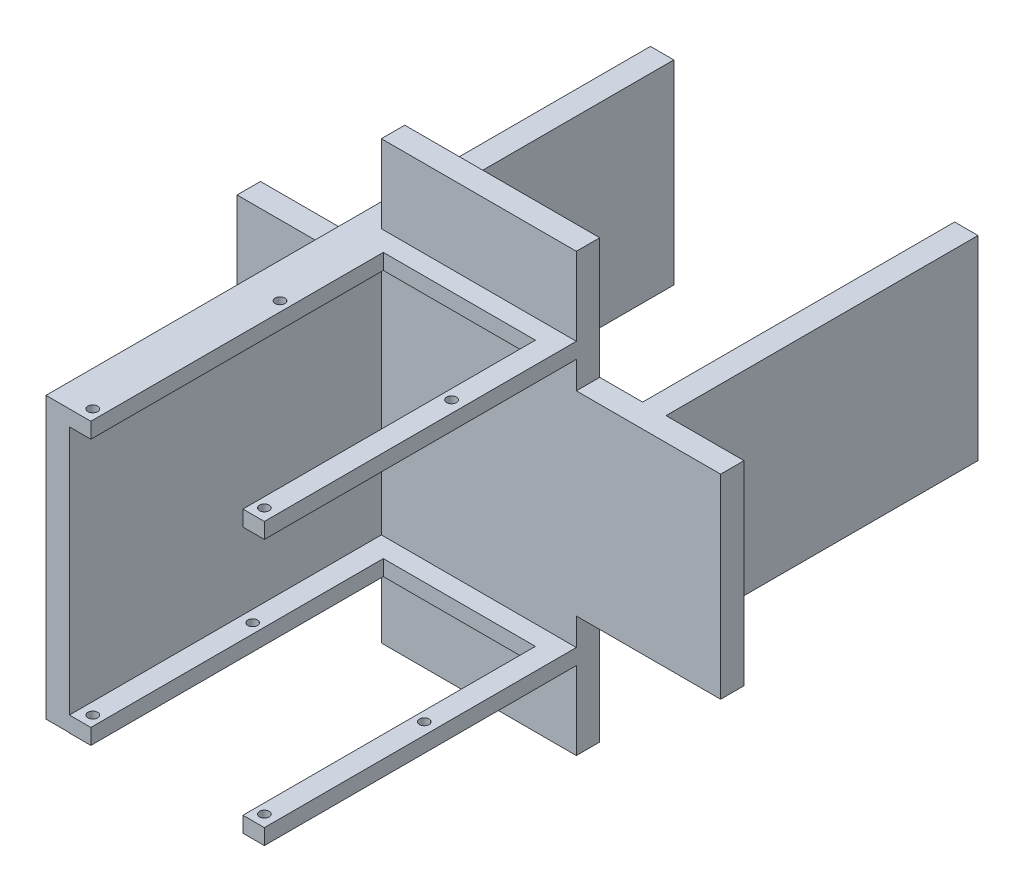
from build123d import *

# Parameters (mm, degrees)
BOSS_EXTRUDE1_DEPTH  = 3
SKETCH2_W            = 25
SKETCH2_H            = 2
BOSS_EXTRUDE2_DEPTH  = 40
SKETCH3_R            = 0.625
CUT_EXTRUDE1_DEPTH   = 3
SKETCH4_R            = 0.625
CUT_EXTRUDE2_DEPTH   = 3
SKETCH5_W            = 3
SKETCH5_H            = 25
BOSS_EXTRUDE3_DEPTH  = 40
SKETCH7_W            = 19.5
SKETCH7_H            = 75
CUT_EXTRUDE5_DEPTH   = 40
SKETCH10_W           = 25
SKETCH10_H           = 3
BOSS_EXTRUDE4_DEPTH  = 10
SKETCH11_W           = 25
SKETCH11_H           = 3
BOSS_EXTRUDE5_DEPTH  = 10
SKETCH12_W           = 3
SKETCH12_H           = 25
BOSS_EXTRUDE6_DEPTH  = 10
SKETCH13_W           = 3
SKETCH13_H           = 25
BOSS_EXTRUDE7_DEPTH  = 10
SKETCH14_W           = 43
SKETCH14_H           = 35.95813892
BOSS_EXTRUDE11_DEPTH = 3


with BuildPart() as part:
    # Sketch1 → Boss-Extrude1 (new body)
    with BuildSketch(Plane.XY):
        Polygon((12.5, 12.5), (21, 12.5), (21, -12.5), (12.5, -12.5), (12.5, -18), (-12.5, -18), (-12.5, -12.5), (-21, -12.5), (-21, 12.5), (-12.5, 12.5), (-12.5, 18), (12.5, 18), align=None)
    extrude(amount=BOSS_EXTRUDE1_DEPTH)

    # Sketch2 → Boss-Extrude2 (add)
    with BuildSketch(Plane.XY.offset(3)):
        with Locations((0, 17)):
            Rectangle(SKETCH2_W, SKETCH2_H)
        with Locations((0, -17)):
            Rectangle(SKETCH2_W, SKETCH2_H)
    extrude(amount=BOSS_EXTRUDE2_DEPTH)

    # Sketch3 → Cut-Extrude1 (cut)
    with BuildSketch(Plane(origin=(0, 18, 0), x_dir=(1, 0, 0), z_dir=(0, 1, 0))):
        with Locations((-11, -17.5)):
            Circle(SKETCH3_R)
        with Locations((11, -17.5)):
            Circle(SKETCH3_R)
        with Locations((-11, -41.5)):
            Circle(SKETCH3_R)
        with Locations((11, -41.5)):
            Circle(SKETCH3_R)
    extrude(amount=-CUT_EXTRUDE1_DEPTH, mode=Mode.SUBTRACT)

    # Sketch4 → Cut-Extrude2 (cut)
    with BuildSketch(Plane(origin=(0, -16, 0), x_dir=(1, 0, 0), z_dir=(0, 1, 0))):
        with Locations((-11, -41.5)):
            Circle(SKETCH4_R)
        with Locations((11, -41.5)):
            Circle(SKETCH4_R)
        with Locations((-10.999346875, -21.00000001)):
            Circle(SKETCH4_R)
        with Locations((11, -21.00000001)):
            Circle(SKETCH4_R)
    extrude(amount=-CUT_EXTRUDE2_DEPTH, mode=Mode.SUBTRACT)

    # Sketch5 → Boss-Extrude3 (add)
    with BuildSketch(Plane(origin=(0, 0, 0), x_dir=(-1, 0, 0), z_dir=(0, 0, -1))):
        with Locations((-19.5, 0)):
            Rectangle(SKETCH5_W, SKETCH5_H)
        with Locations((19.5, 0)):
            Rectangle(SKETCH5_W, SKETCH5_H)
    extrude(amount=BOSS_EXTRUDE3_DEPTH)

    # Sketch7 → Cut-Extrude5 (cut)
    with BuildSketch(Plane(origin=(0, 18, 0), x_dir=(1, 0, 0), z_dir=(0, 1, 0))):
        with Locations((0, -43)):
            Rectangle(SKETCH7_W, SKETCH7_H)
    extrude(amount=-CUT_EXTRUDE5_DEPTH, mode=Mode.SUBTRACT)

    # Sketch10 → Boss-Extrude4 (add)
    with BuildSketch(Plane(origin=(0, 18, 0), x_dir=(1, 0, 0), z_dir=(0, 1, 0))):
        with Locations((0, -1.5)):
            Rectangle(SKETCH10_W, SKETCH10_H)
    extrude(amount=BOSS_EXTRUDE4_DEPTH)

    # Sketch11 → Boss-Extrude5 (add)
    with BuildSketch(Plane.XZ.offset(18)):
        with Locations((0, 1.5)):
            Rectangle(SKETCH11_W, SKETCH11_H)
    extrude(amount=BOSS_EXTRUDE5_DEPTH)

    # Sketch12 → Boss-Extrude6 (add)
    with BuildSketch(Plane.ZY.offset(21)):
        with Locations((1.5, 0)):
            Rectangle(SKETCH12_W, SKETCH12_H)
    extrude(amount=BOSS_EXTRUDE6_DEPTH)

    # Sketch13 → Boss-Extrude7 (add)
    with BuildSketch(Plane(origin=(21, 0, 0), x_dir=(0, 0, -1), z_dir=(1, 0, 0))):
        with Locations((-1.5, 0)):
            Rectangle(SKETCH13_W, SKETCH13_H)
    extrude(amount=BOSS_EXTRUDE7_DEPTH)

    # Sketch14 → Boss-Extrude11 (add)
    with BuildSketch(Plane.ZY.offset(12.5)):
        with Locations((21.5, 0.02093054)):
            Rectangle(SKETCH14_W, SKETCH14_H)
    extrude(amount=BOSS_EXTRUDE11_DEPTH)


solid = part.part
